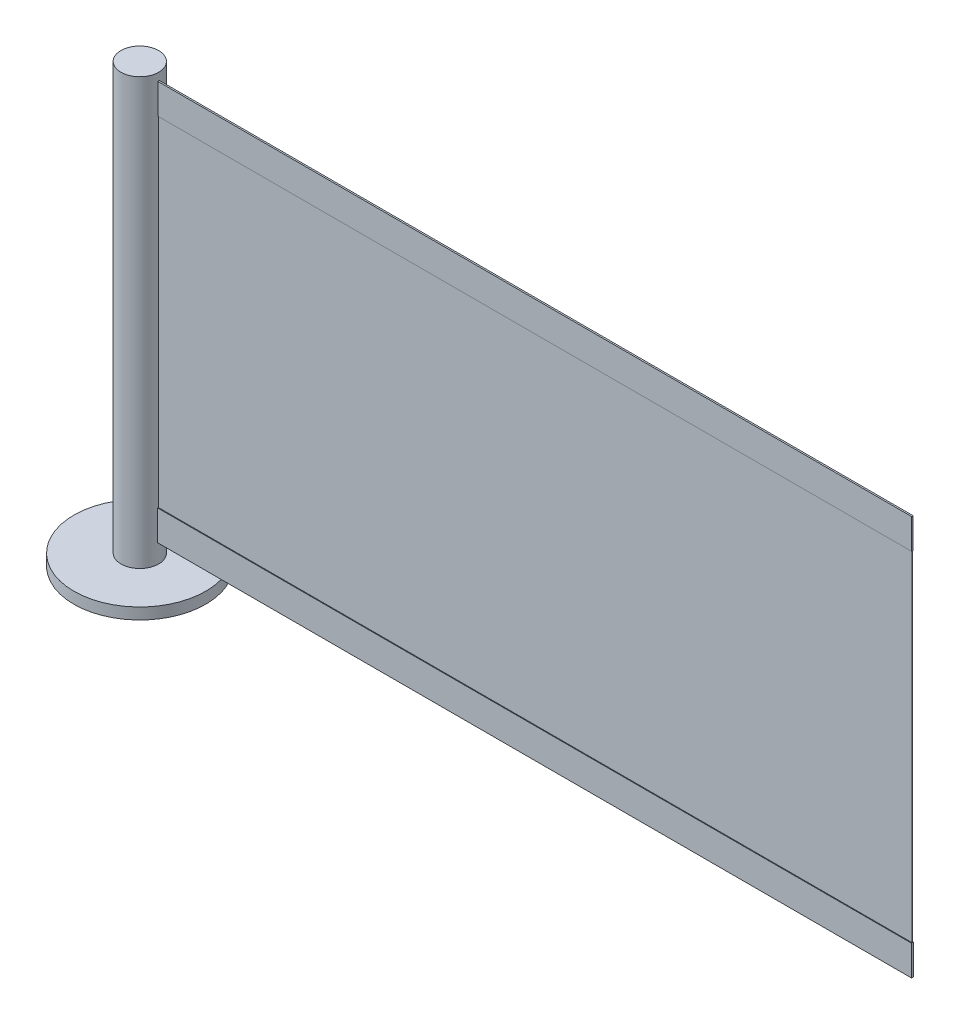
from build123d import *

# Parameters (mm, degrees)
SKETCH2_R           = 175
BOSS_EXTRUDE1_DEPTH = 30
SKETCH3_R           = 50
BOSS_EXTRUDE2_DEPTH = 1110
SKETCH7_W           = 2050
SKETCH7_H           = 1
BOSS_EXTRUDE3_DEPTH = 1060
SKETCH8_W           = 2050
SKETCH8_H           = 4
BOSS_EXTRUDE4_DEPTH = 80
SKETCH11_W          = 2050
SKETCH11_H          = 4.938385514
BOSS_EXTRUDE5_DEPTH = 80
SKETCH12_R          = 50
BOSS_EXTRUDE6_DEPTH = 20


with BuildPart() as part:
    # Sketch2 → Boss-Extrude1 (new body)
    with BuildSketch(Plane(origin=(0, 0, 0), x_dir=(1, 0, 0), z_dir=(0, 1, 0))):
        Circle(SKETCH2_R)
    extrude(amount=BOSS_EXTRUDE1_DEPTH)

    # Sketch3 → Boss-Extrude2 (add)
    with BuildSketch(Plane(origin=(0, 30, 0), x_dir=(1, 0, 0), z_dir=(0, 1, 0))):
        Circle(SKETCH3_R)
    extrude(amount=BOSS_EXTRUDE2_DEPTH)

    # Sketch7 → Boss-Extrude3 (add)
    with BuildSketch(Plane(origin=(0, 1140, 0), x_dir=(1, 0, 0), z_dir=(0, 1, 0))):
        with Locations((1025, 0)):
            Rectangle(SKETCH7_W, SKETCH7_H)
    extrude(amount=-BOSS_EXTRUDE3_DEPTH)

    # Sketch8 → Boss-Extrude4 (add)
    with BuildSketch(Plane(origin=(0, 1140, 0), x_dir=(1, 0, 0), z_dir=(0, 1, 0))):
        with Locations((1025, 0)):
            Rectangle(SKETCH8_W, SKETCH8_H)
    extrude(amount=-BOSS_EXTRUDE4_DEPTH)

    # Sketch11 → Boss-Extrude5 (add)
    with BuildSketch(Plane(origin=(0, 80, 0), x_dir=(-1, 0, 0), z_dir=(0, -1, 0))):
        with Locations((-1025, 0)):
            Rectangle(SKETCH11_W, SKETCH11_H)
    extrude(amount=-BOSS_EXTRUDE5_DEPTH)

    # Sketch12 → Boss-Extrude6 (add)
    with BuildSketch(Plane(origin=(0, 1140, 0), x_dir=(1, 0, 0), z_dir=(0, 1, 0))):
        Circle(SKETCH12_R)
    extrude(amount=BOSS_EXTRUDE6_DEPTH)


solid = part.part
